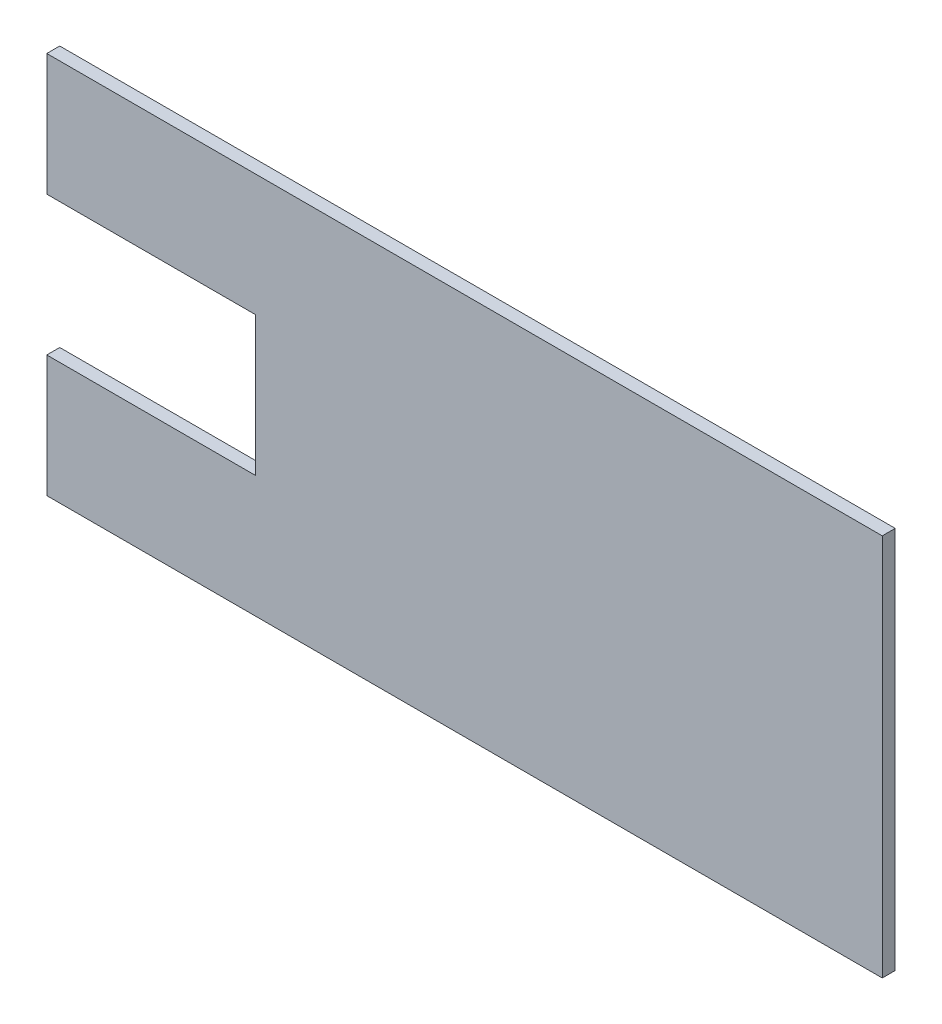
from build123d import *

# Parameters (mm, degrees)
SKETCH1_W           = 152.4
SKETCH1_H           = 69.85
BOSS_EXTRUDE1_DEPTH = 2.3622
SKETCH2_W           = 38.1
SKETCH2_H           = 25.4
CUT_EXTRUDE1_DEPTH  = 168.661452006


with BuildPart() as part:
    # Sketch1 → Boss-Extrude1 (new body)
    with BuildSketch(Plane.XY):
        with Locations((76.2, 34.925)):
            Rectangle(SKETCH1_W, SKETCH1_H)
    extrude(amount=BOSS_EXTRUDE1_DEPTH)

    # Sketch2 → Cut-Extrude1 (cut, through all)
    with BuildSketch(Plane.XY.offset(2.3622)):
        with Locations((19.05, 34.925)):
            Rectangle(SKETCH2_W, SKETCH2_H)
    extrude(amount=-CUT_EXTRUDE1_DEPTH, mode=Mode.SUBTRACT)


solid = part.part
